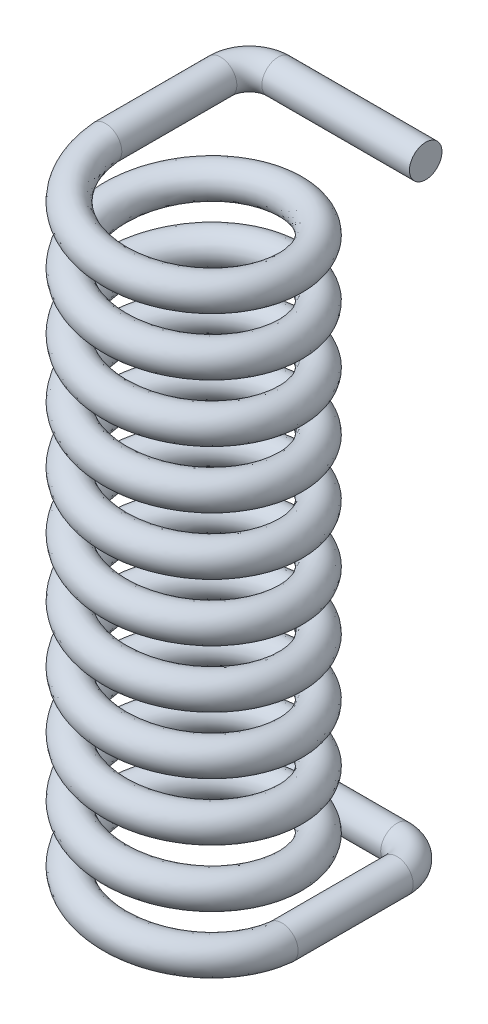
from build123d import *

# Parameters (mm, degrees)
SWEEP1_PITCH       = 4
SWEEP1_HEIGHT      = 42
SWEEP1_RADIUS      = 6.13
SWEEP1_START_ANGLE = 90
SKETCH1_R          = 1.13
SKETCH1_3_R        = 1.13
SWEEP3_OUTLINE_R   = 1.13
SWEEP3_ANGLE       = 90
SWEEP3_START       = -8.0000001
SWEEP3_2_OUTLINE_R = 1.13
SWEEP3_2_DEPTH     = 8.0000001
SWEEP3_START_2     = -4.1300001
SWEEP3_3_OUTLINE_R = 1.13
SWEEP3_3_DEPTH     = 10.2600001


with BuildPart() as part:
    # Sweep1: sweep along a helix
    with BuildLine() as sweep1_path:
        add(Helix(SWEEP1_PITCH, SWEEP1_HEIGHT, SWEEP1_RADIUS, center=(0, 0, 0), direction=(0, 1, 0), lefthand=True, mode=Mode.PRIVATE).rotate(Axis((0, 0, 0), (0, 1, 0)), SWEEP1_START_ANGLE))
    # Sketch1 → Sweep1 (sweep)
    with BuildSketch(Plane.XY):
        with Locations((6.13, 0)):
            Circle(SKETCH1_R)
    sweep(path=sweep1_path.line, is_frenet=True)

    # Sweep2: sweep along a path in Sketch3
    with BuildLine(Plane(origin=(0, 0, 0), x_dir=(1, 0, 0), z_dir=(0, 1, 0))) as sweep2_path:
        Line((6.13, 0), (6.13, 8))
        ThreePointArc((6.13, 8), (5.544213562, 9.414213562), (4.13, 10))
        Line((4.13, 10), (-6.13, 10))
    # Sketch1<3> → Sweep2 (sweep)
    with BuildSketch(Plane.XY):
        with Locations((6.13, 0)):
            Circle(SKETCH1_3_R)
    sweep(path=sweep2_path.line)



with BuildPart() as body_2:
    # Sweep3: read off the stored shape, not the designer's step
    # Sweep3 outline → Sweep3 (revolve)
    with BuildSketch(Plane(origin=(-4.13, 0, -8), x_dir=(0, 0, -1), z_dir=(1, 0, 0))):
        with Locations((2, 42)):
            Circle(SWEEP3_OUTLINE_R)
    revolve(axis=Axis((-4.13, 0, -8), (0, 1, 0)), revolution_arc=SWEEP3_ANGLE)


with BuildPart() as part_1:
    add(part.part)

    add(body_2.part)  # Sweep3 2 merges body 2
    # Sweep3 2 outline → Sweep3 2 (add)
    with BuildSketch(Plane.XY.offset(SWEEP3_START)):
        with Locations((-6.13, 42)):
            Circle(SWEEP3_2_OUTLINE_R)
    extrude(amount=SWEEP3_2_DEPTH)

    # Sweep3 3 outline → Sweep3 3 (add)
    with BuildSketch(Plane.YZ.offset(SWEEP3_START_2)):
        with Locations((42, -10)):
            Circle(SWEEP3_3_OUTLINE_R)
    extrude(amount=SWEEP3_3_DEPTH)


solid = part_1.part
